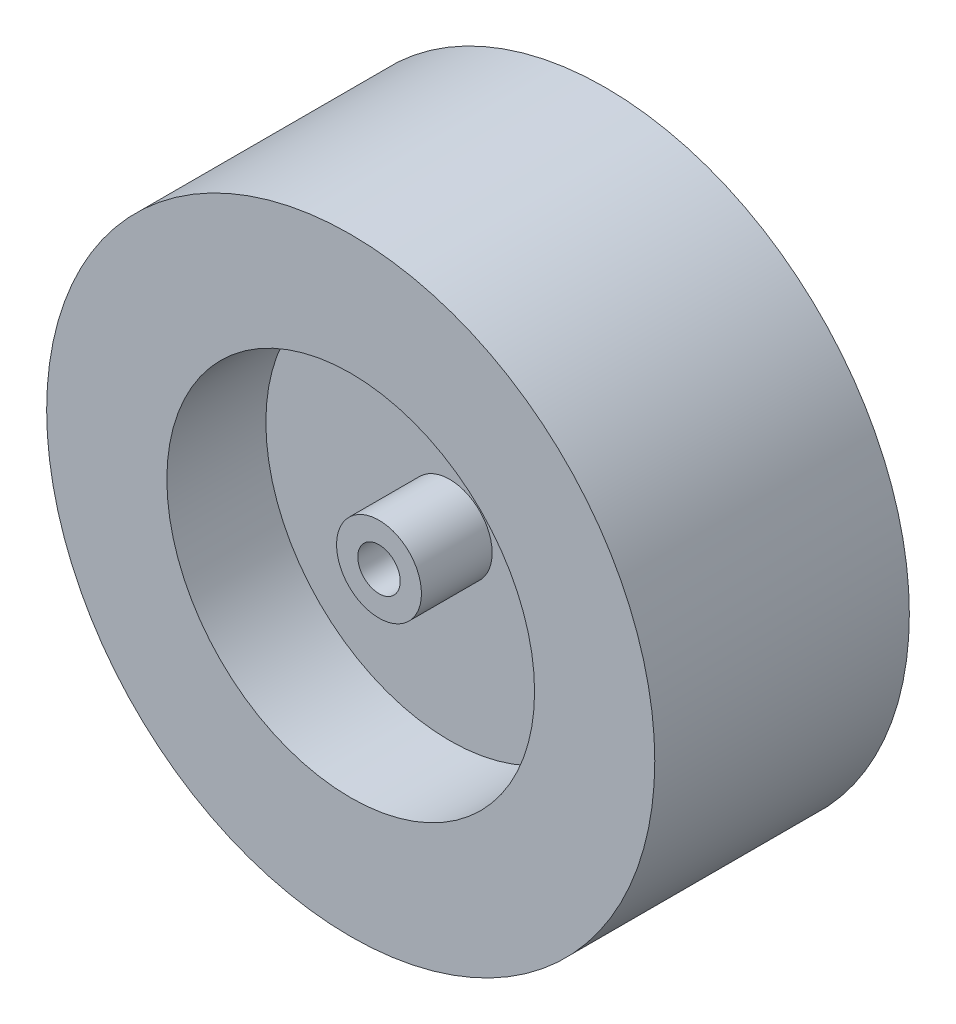
from build123d import *

# Parameters (mm, degrees)
BOSS_EXTRUDE7_DEPTH      = 7
BOSS_EXTRUDE7_DEPTH_BACK = 3
SKETCH1_R                = 3
SKETCH1_R_2              = 1.5
SKETCH1_10_R             = 21.5
SKETCH1_10_R_2           = 13
BOSS_EXTRUDE8_DEPTH      = 9
SKETCH1_11_R             = 13
SKETCH1_11_R_2           = 3
BOSS_EXTRUDE9_DEPTH      = 2


with BuildPart() as part:
    # Sketch1 → Boss-Extrude7 (new, two sides: drawn at the far end of the back side and taken through both)
    with BuildSketch(Plane.XY.offset(-BOSS_EXTRUDE7_DEPTH_BACK)):
        Circle(SKETCH1_R)
        Circle(SKETCH1_R_2, mode=Mode.SUBTRACT)
    extrude(amount=BOSS_EXTRUDE7_DEPTH + BOSS_EXTRUDE7_DEPTH_BACK)



with BuildPart() as body_2:
    # Sketch1<10> → Boss-Extrude8 (new, symmetric)
    with BuildSketch(Plane.XY):
        Circle(SKETCH1_10_R)
        Circle(SKETCH1_10_R_2, mode=Mode.SUBTRACT)
    extrude(amount=BOSS_EXTRUDE8_DEPTH, both=True)


with BuildPart() as part_1:
    add(part.part)

    add(body_2.part)  # Boss-Extrude9 merges body 2
    # Sketch1<11> → Boss-Extrude9 (add, symmetric)
    with BuildSketch(Plane.XY):
        Circle(SKETCH1_11_R)
        Circle(SKETCH1_11_R_2, mode=Mode.SUBTRACT)
    extrude(amount=BOSS_EXTRUDE9_DEPTH, both=True)


solid = part_1.part
